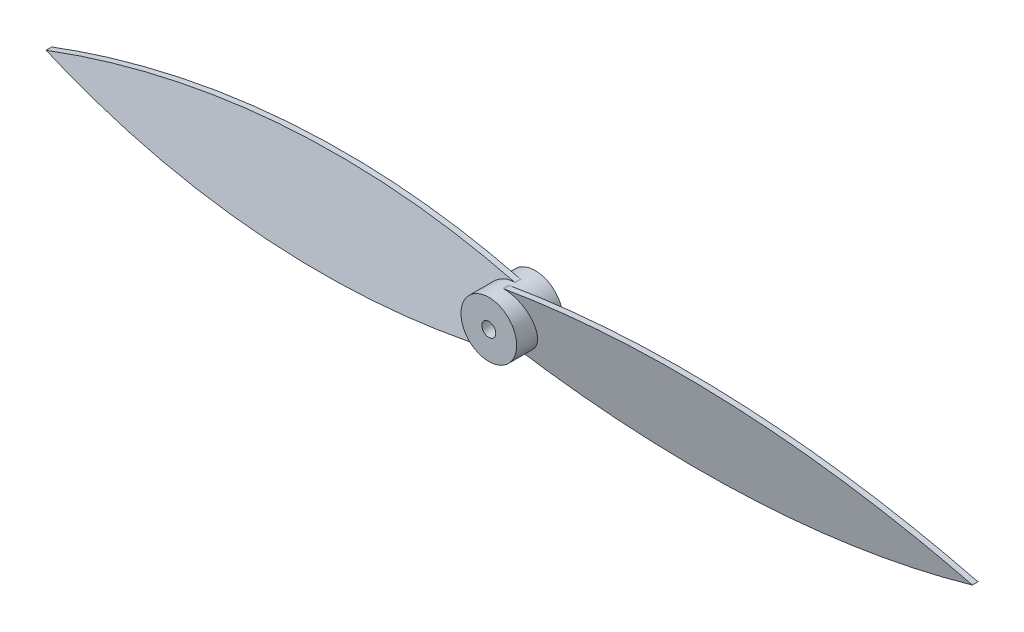
from build123d import *

# Parameters (mm, degrees)
SKETCH1_R           = 6.000000000000002
SKETCH1_R_2         = 1.4999999999999918
BOSS_EXTRUDE1_DEPTH = 10
BOSS_EXTRUDE2_DEPTH = 125
CUT_EXTRUDE1_START  = -10.588348405
CUT_EXTRUDE1_DEPTH  = 11.17669681
CIRPATTERN1_COUNT   = 2


# Read off the part's stored shape, not the designer's step: Cut-Extrude1
with BuildPart() as part:
    # Sketch1 → Boss-Extrude1 (new body)
    with BuildSketch(Plane.XY):
        with Locations((0.1399887701091363, 164.8507075610879)):
            Circle(SKETCH1_R)
        with Locations((0.1399887701091363, 164.8507075610879)):
            Circle(SKETCH1_R_2, mode=Mode.SUBTRACT)
    extrude(amount=-BOSS_EXTRUDE1_DEPTH)

    # Sketch2 → Boss-Extrude2 (add)
    with BuildSketch(Plane(origin=(0, 0, 0), x_dir=(0, 0, -1), z_dir=(1, 0, 0))):
        Polygon((-0.5883484054145544, 189.73303788000499), (9.411651594585447, 139.73303788000499), (10.58834840541455, 139.9683772421708), (0.5883484054145496, 189.9683772421708), align=None)
    boss_extrude2 = extrude(amount=BOSS_EXTRUDE2_DEPTH)

    # Cut-Extrude1 outline → Cut-Extrude1 (cut)
    with BuildSketch(Plane.XY.offset(CUT_EXTRUDE1_START)):
        with BuildLine():
            Line((0, 170.850707561), (0.13998877, 170.850707561))
            ThreePointArc((0.13998877, 170.850707561), (50.466362146, 174.447589067), (100, 164.850707561))
            ThreePointArc((100, 164.850707561), (50.466362146, 155.253826055), (0.13998877, 158.850707561))
            Line((0.13998877, 158.850707561), (0, 158.850707561))
            Line((0, 158.850707561), (0, 131.123594735))
            Line((0, 131.123594735), (135.475544018, 131.123594735))
            Line((135.475544018, 131.123594735), (135.475544018, 197.042094646))
            Line((135.475544018, 197.042094646), (0, 197.042094646))
            Line((0, 197.042094646), (0, 170.850707561))
        make_face()
    cut_extrude1 = extrude(amount=CUT_EXTRUDE1_DEPTH, mode=Mode.SUBTRACT)

    # CirPattern1: Boss-Extrude2, Cut-Extrude1 ×2 about axis
    cirpattern1_axis = Axis((0.1399887701089445, 164.85070756108797, 0), (0, 0, 1))
    add([boss_extrude2.rotate(cirpattern1_axis, i * 360 / CIRPATTERN1_COUNT) for i in range(1, CIRPATTERN1_COUNT)])
    add([cut_extrude1.rotate(cirpattern1_axis, i * 360 / CIRPATTERN1_COUNT) for i in range(1, CIRPATTERN1_COUNT)], mode=Mode.SUBTRACT)


solid = part.part
